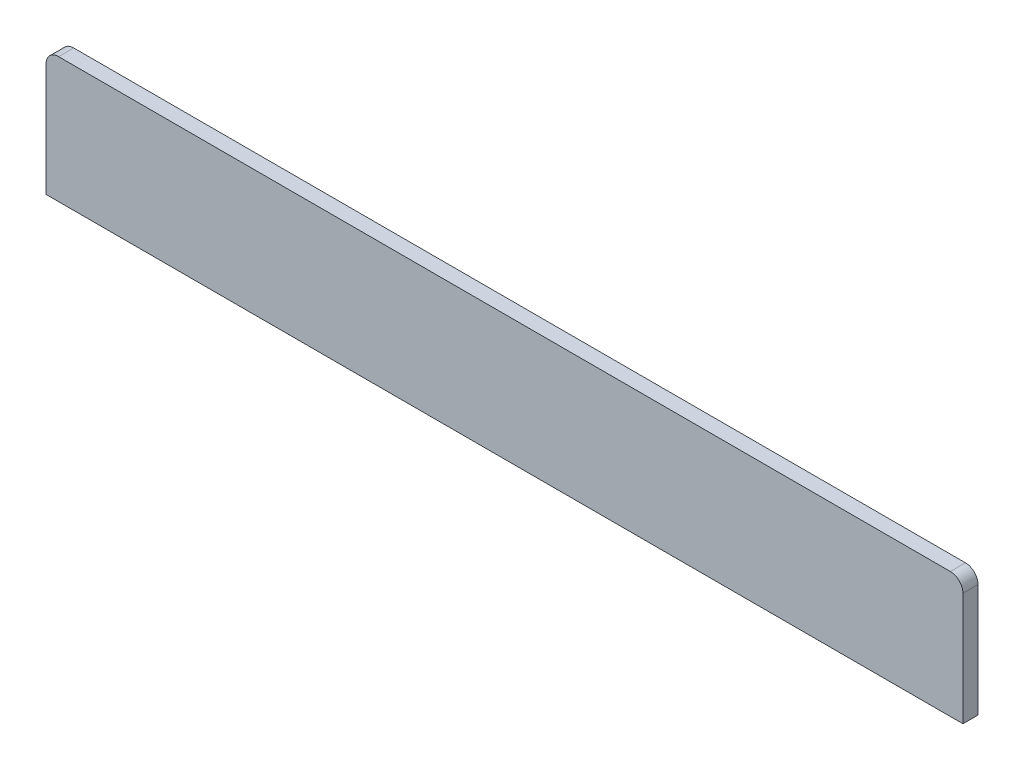
from build123d import *

# Parameters (mm, degrees)
EXTRUDE_1_DEPTH = 6


with BuildPart() as part:
    # Эскиз1 → Бобышка-Вытянуть1 (new body)
    with BuildSketch(Plane.XY):
        with BuildLine():
            Line((5, 0), (360, 0))
            ThreePointArc((360, 0), (363.535533906, -1.464466094), (365, -5))
            Line((365, -5), (365, -50))
            Line((365, -50), (0, -50))
            Line((0, -50), (0, -5))
            ThreePointArc((0, -5), (1.464466094, -1.464466094), (5, 0))
        make_face()
    extrude(amount=EXTRUDE_1_DEPTH)


solid = part.part
